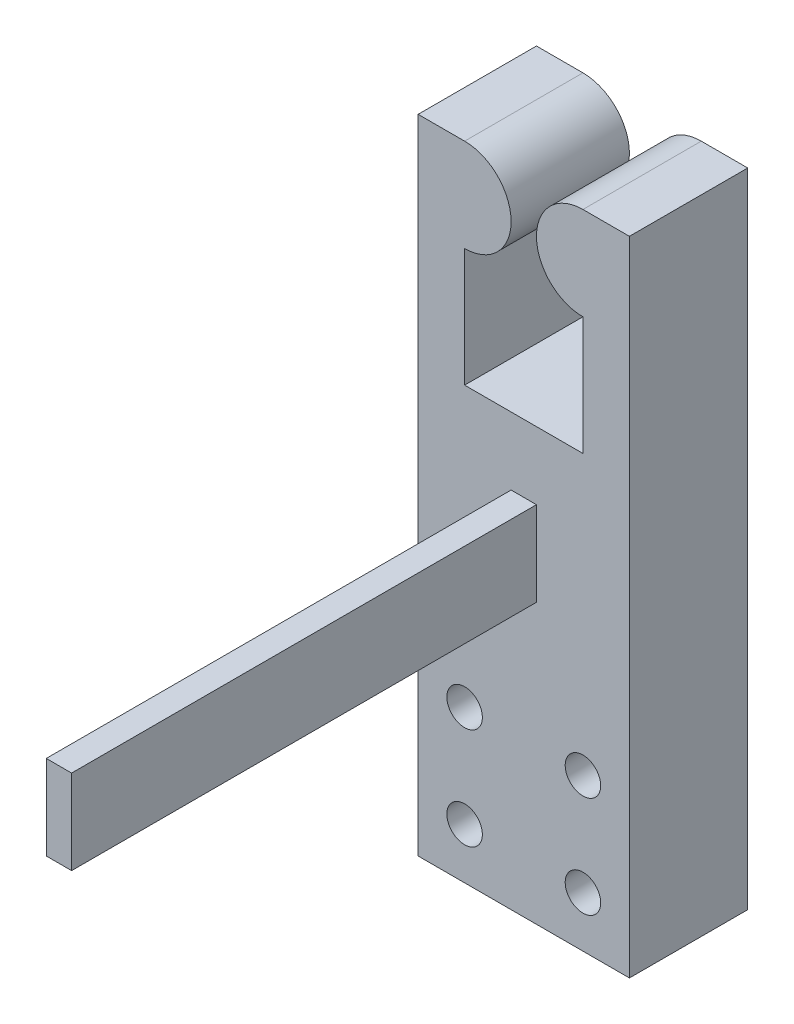
from build123d import *

# Parameters (mm, degrees)
SKETCH_1_W          = 25
SKETCH_1_H          = 76
EXTRUDE_1_DEPTH     = 14
SKETCH_2_W          = 3
SKETCH_2_H          = 10
EXTRUDE_2_DEPTH     = 55
SKETCH_3_R          = 2.1
CUT_EXTRUDE_1_DEPTH = 69.009190555
CUT_EXTRUDE_3_DEPTH = 69.009190555
SKETCH_6_R          = 3
CUT_EXTRUDE_4_DEPTH = 5


with BuildPart() as part:
    # 草图1 → 凸台-拉伸1 (new body)
    with BuildSketch(Plane.XY):
        Rectangle(SKETCH_1_W, SKETCH_1_H)
    extrude(amount=EXTRUDE_1_DEPTH)

    # 草图2 → 凸台-拉伸2 (add)
    with BuildSketch(Plane.XY.offset(14)):
        Rectangle(SKETCH_2_W, SKETCH_2_H)
    extrude(amount=EXTRUDE_2_DEPTH)

    # 草图3 → 切除-拉伸1 (cut, through all)
    with BuildSketch(Plane.XY.offset(14)):
        with Locations((-7, -20)):
            Circle(SKETCH_3_R)
        with Locations((-7, -32)):
            Circle(SKETCH_3_R)
        with Locations((7, -32)):
            Circle(SKETCH_3_R)
        with Locations((7, -20)):
            Circle(SKETCH_3_R)
    extrude(amount=-CUT_EXTRUDE_1_DEPTH, mode=Mode.SUBTRACT)

    # 草图5 → 切除-拉伸3 (cut, through all)
    with BuildSketch(Plane.XY.offset(14)):
        with BuildLine():
            Line((-7, 13), (7, 13))
            Line((7, 13), (7, 27))
            ThreePointArc((7, 27), (1.5, 32.5), (7, 38))
            Line((7, 38), (-7, 38))
            ThreePointArc((-7, 38), (-1.5, 32.5), (-7, 27))
            Line((-7, 27), (-7, 13))
        make_face()
    extrude(amount=-CUT_EXTRUDE_3_DEPTH, mode=Mode.SUBTRACT)

    # 草图6 → 切除-拉伸4 (cut)
    with BuildSketch(Plane(origin=(0, 0, 0), x_dir=(-1, 0, 0), z_dir=(0, 0, -1))):
        with Locations((7, -20)):
            Circle(SKETCH_6_R)
        with Locations((-7, -20)):
            Circle(SKETCH_6_R)
        with Locations((-7, -32)):
            Circle(SKETCH_6_R)
        with Locations((7, -32)):
            Circle(SKETCH_6_R)
    extrude(amount=-CUT_EXTRUDE_4_DEPTH, mode=Mode.SUBTRACT)


solid = part.part
